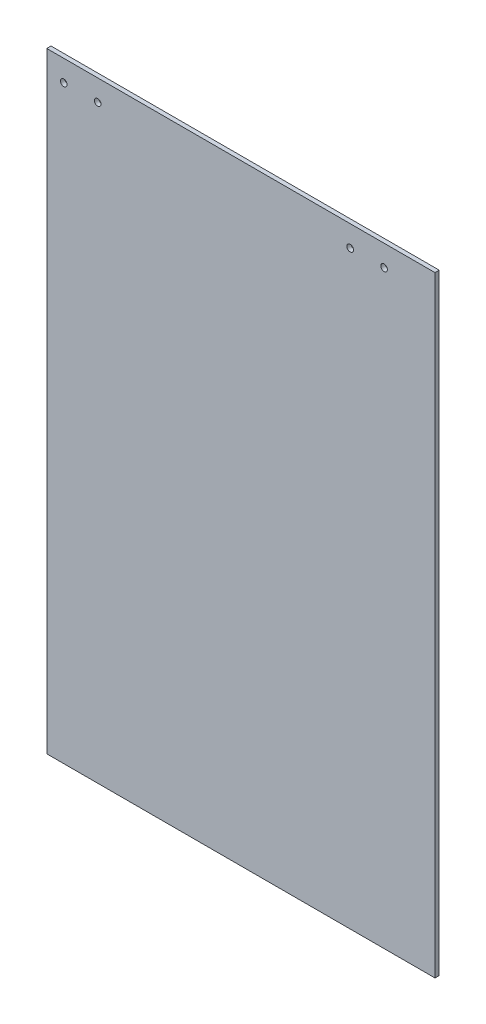
from build123d import *

# Parameters (mm, degrees)
SKETCH1_W                  = 457.2
SKETCH1_H                  = 290.576
BOSS_EXTRUDE1_DEPTH        = 3.175
F_9_0_196_DIAMETER_HOLE2_D = 4.9784


with BuildPart() as part:
    # Sketch1 → Boss-Extrude1 (new body)
    with BuildSketch(Plane(origin=(0, 0, 0), x_dir=(0, 1, 0), z_dir=(0, 0, 1))):
        Rectangle(SKETCH1_W, SKETCH1_H)
    extrude(amount=BOSS_EXTRUDE1_DEPTH)

    # #9 (0.196) Diameter Hole2 (through all)
    with Locations(Plane.XY.offset(3.175)):
        with Locations((-132.588, 212.725), (-107.188, 212.725), (81.788, 212.725), (107.188, 212.725)):
            Hole(F_9_0_196_DIAMETER_HOLE2_D / 2)


solid = part.part
